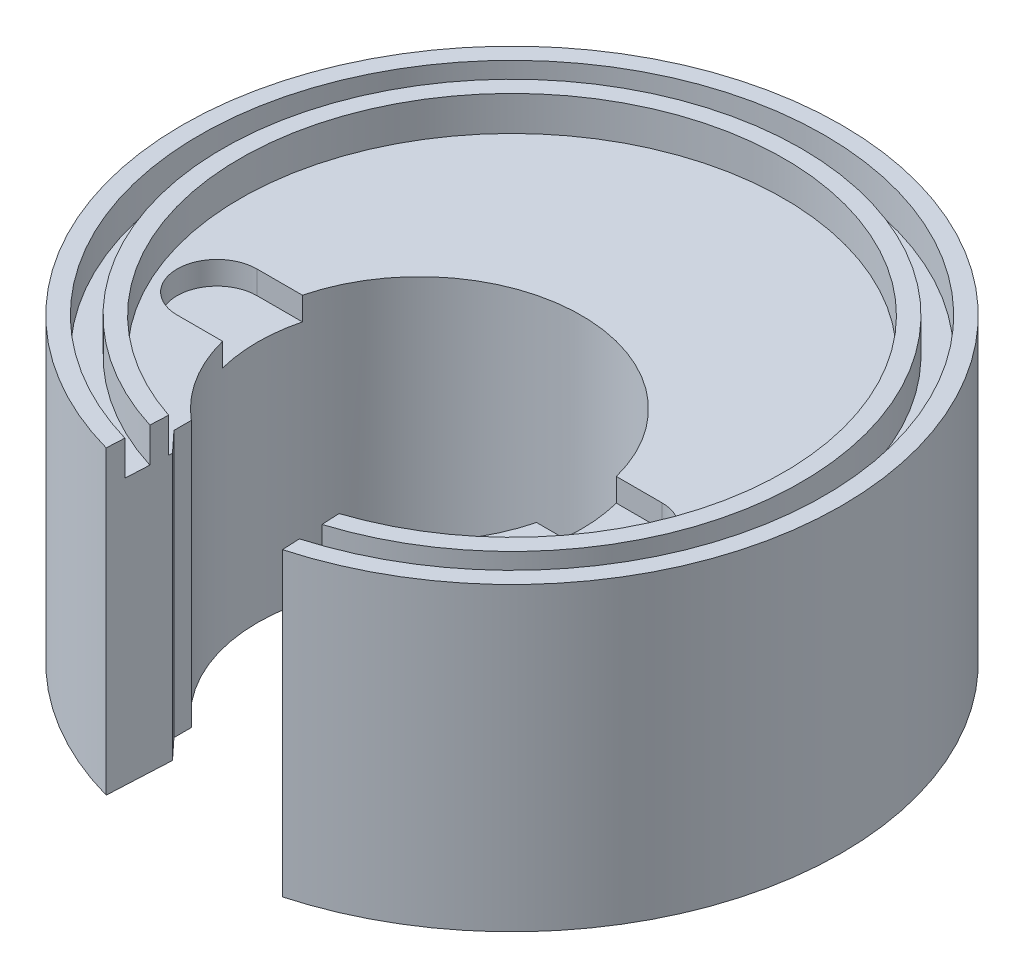
from build123d import *
from build123d.topology import SkipClean

# Parameters (mm, degrees)
SKETCH1_R           = 28.5
BOSS_EXTRUDE1_DEPTH = 3
BOSS_EXTRUDE4_DEPTH = 20
BOSS_EXTRUDE7_DEPTH = 3
CUT_EXTRUDE1_START  = -2
CUT_EXTRUDE1_DEPTH  = 2
CUT_EXTRUDE5_START  = -4
CUT_EXTRUDE5_DEPTH  = 4


with BuildPart() as part:
    # Sketch1 → Boss-Extrude1 (new body)
    with BuildSketch(Plane(origin=(0, 0, 0), x_dir=(1, 0, 0), z_dir=(0, 1, 0))):
        Circle(SKETCH1_R)
    extrude(amount=BOSS_EXTRUDE1_DEPTH)

    # Sketch2 → Boss-Extrude4 (add)
    with BuildSketch(Plane(origin=(0, 3, 0), x_dir=(1, 0, 0), z_dir=(0, 1, 0))):
        with BuildLine():
            Line((-9, -20.223805295), (-9, -18.723805295))
            ThreePointArc((-9, -18.723805295), (-11.855740218, -15.445899804), (-13.568253388, -11.45))
            ThreePointArc((-13.568253388, -11.45), (-14, -8), (-13.568253388, -4.55))
            ThreePointArc((-13.568253388, -4.55), (0, 6), (13.568253388, -4.55))
            ThreePointArc((13.568253388, -4.55), (14, -8), (13.568253388, -11.45))
            ThreePointArc((13.568253388, -11.45), (11.855740218, -15.445899804), (9, -18.723805295))
            Line((9, -18.723805295), (9, -20.223805295))
            Line((9, -20.223805295), (7.35, -22))
            Line((7.35, -22), (7.617272727, -27.463196394))
            ThreePointArc((7.617272727, -27.463196394), (22.686364547, -17.250474302), (28.5, 0))
            ThreePointArc((28.5, 0), (-17.250474302, 22.686364547), (-7.617272727, -27.463196394))
            Line((-7.617272727, -27.463196394), (-7.35, -22))
            Line((-7.35, -22), (-9, -20.223805295))
        make_face()
    extrude(amount=BOSS_EXTRUDE4_DEPTH)

    # Sketch5 → Boss-Extrude7 (add)
    with BuildSketch(Plane(origin=(0, 23, 0), x_dir=(1, 0, 0), z_dir=(0, 1, 0))):
        with BuildLine():
            ThreePointArc((7.617272727, -27.463196394), (0, 28.5), (-7.617272727, -27.463196394))
            Line((-7.617272727, -27.463196394), (-7.542031899, -25.92523394))
            ThreePointArc((-7.542031899, -25.92523394), (0, 27), (7.542031899, -25.92523394))
            Line((7.542031899, -25.92523394), (7.617272727, -27.463196394))
        make_face()
        with BuildLine():
            ThreePointArc((7.441330866, -23.866851383), (0, 25), (-7.441330866, -23.866851383))
            Line((-7.441330866, -23.866851383), (-7.365455329, -22.315915124))
            ThreePointArc((-7.365455329, -22.315915124), (0, 23.5), (7.365455329, -22.315915124))
            Line((7.365455329, -22.315915124), (7.441330866, -23.866851383))
        make_face()
    extrude(amount=BOSS_EXTRUDE7_DEPTH)

    # Sketch6 → Cut-Extrude1 (cut)
    with SkipClean():  # the faces are left unmerged after this step: merging them gives an invalid solid
        with BuildSketch(Plane(origin=(0, 23, 0), x_dir=(1, 0, 0), z_dir=(0, 1, 0)).offset(CUT_EXTRUDE1_START)):
            with BuildLine():
                Line((13.568253388, -11.45), (17.5, -11.45))
                ThreePointArc((17.5, -11.45), (20.95, -8), (17.5, -4.55))
                Line((17.5, -4.55), (13.568253388, -4.55))
                ThreePointArc((13.568253388, -4.55), (0, 6), (-13.568253388, -4.55))
                Line((-13.568253388, -4.55), (-17.5, -4.55))
                ThreePointArc((-17.5, -4.55), (-20.95, -8), (-17.5, -11.45))
                Line((-17.5, -11.45), (-13.568253388, -11.45))
                ThreePointArc((-13.568253388, -11.45), (-11.855740218, -15.445899804), (-9, -18.723805295))
                Line((-9, -18.723805295), (-9, -20.223805295))
                Line((-9, -20.223805295), (-7.35, -22))
                Line((-7.35, -22), (-7.35, -25))
                Line((-7.35, -25), (7.35, -25))
                Line((7.35, -25), (7.35, -22))
                Line((7.35, -22), (9, -20.223805295))
                Line((9, -20.223805295), (9, -18.723805295))
                ThreePointArc((9, -18.723805295), (11.855740218, -15.445899804), (13.568253388, -11.45))
            make_face()
        extrude(amount=CUT_EXTRUDE1_DEPTH, mode=Mode.SUBTRACT)

    # Sketch7 → Cut-Extrude5 (cut)
    with BuildSketch(Plane(origin=(0, 3, 0), x_dir=(1, 0, 0), z_dir=(0, 1, 0)).offset(CUT_EXTRUDE5_START)):
        with BuildLine():
            Line((-9, -20.223805295), (-7.35, -22))
            Line((-7.35, -22), (-7.617272727, -27.463196394))
            ThreePointArc((-7.617272727, -27.463196394), (0, -28.5), (7.617272727, -27.463196394))
            Line((7.617272727, -27.463196394), (7.35, -22))
            Line((7.35, -22), (9, -20.223805295))
            Line((9, -20.223805295), (9, -18.723805295))
            ThreePointArc((9, -18.723805295), (0, 6), (-9, -18.723805295))
            Line((-9, -18.723805295), (-9, -20.223805295))
        make_face()
    extrude(amount=CUT_EXTRUDE5_DEPTH, mode=Mode.SUBTRACT)


solid = part.part
